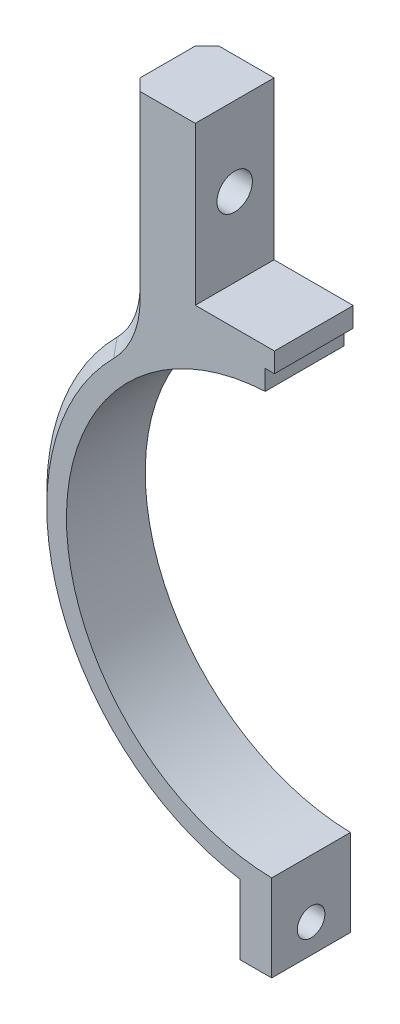
from build123d import *

# Parameters (mm, degrees)
AUFSATZ_LINEAR_AUSTRAGEN1_DEPTH = 10
SKIZZE2_R                       = 1.75
SCHNITT_LINEAR_AUSTRAGEN1_DEPTH = 64.134024107
SKIZZE4_R                       = 2.25
SCHNITT_LINEAR_AUSTRAGEN3_DEPTH = 72.992812141
VERRUNDUNG1_R                   = 10
SCHNITT_LINEAR_AUSTRAGEN5_DEPTH = 61.751172828
FASE1_SIZE                      = 1.5
SCHNITT_LINEAR_AUSTRAGEN6_DEPTH = 61.751172828


with BuildPart() as part:
    # Skizze1 → Aufsatz-Linear austragen1 (new body)
    with BuildSketch(Plane.XY):
        with BuildLine():
            Line((0.5, -26.545291485), (0.5, -30.545908073))
            Line((0.5, -30.545908073), (0.5, -37.545908073))
            Line((0.5, -37.545908073), (4.5, -37.545908073))
            Line((4.5, -37.545908073), (4.5, -30.216758595))
            ThreePointArc((4.5, -30.216758595), (29.558680329, -7.719256261), (18.7, 24.158073185))
            Line((18.7, 24.158073185), (18.7, 51.55))
            Line((18.7, 51.55), (10.2, 51.55))
            Line((10.2, 51.55), (10.2, 31.55))
            Line((10.2, 31.55), (-10.2, 31.55))
            Line((-10.2, 31.55), (-10.2, 51.55))
            Line((-10.2, 51.55), (-18.7, 51.55))
            Line((-18.7, 51.55), (-18.7, 24.158073185))
            ThreePointArc((-18.7, 24.158073185), (-29.558680329, -7.719256261), (-4.5, -30.216758595))
            Line((-4.5, -30.216758595), (-4.5, -37.545908073))
            Line((-4.5, -37.545908073), (-0.5, -37.545908073))
            Line((-0.5, -37.545908073), (-0.5, -30.545908073))
            Line((-0.5, -30.545908073), (-0.5, -26.545291485))
            ThreePointArc((-0.5, -26.545291485), (0, 26.55), (0.5, -26.545291485))
        make_face()
    extrude(amount=AUFSATZ_LINEAR_AUSTRAGEN1_DEPTH)

    # Skizze2 → Schnitt-Linear austragen1 (cut, through all)
    with BuildSketch(Plane.ZY.offset(4.5)):
        with Locations((5, -33.881333334)):
            Circle(SKIZZE2_R)
    extrude(amount=-SCHNITT_LINEAR_AUSTRAGEN1_DEPTH, mode=Mode.SUBTRACT)

    # Skizze4 → Schnitt-Linear austragen3 (cut, through all)
    with BuildSketch(Plane.ZY.offset(18.7)):
        with Locations((5, 41.55)):
            Circle(SKIZZE4_R)
    extrude(amount=-SCHNITT_LINEAR_AUSTRAGEN3_DEPTH, mode=Mode.SUBTRACT)

    # Verrundung1
    verrundung1_edges = [part.edges().sort_by_distance(p)[0] for p in [
        (18.7, 24.158073185, 5),
        (-18.7, 24.158073185, 5),
    ]]
    fillet(verrundung1_edges, radius=VERRUNDUNG1_R)

    # Skizze6 → Schnitt-Linear austragen5 (cut, through all)
    with BuildSketch(Plane.XY):
        Polygon((0, 0), (0, 63.91348789), (40.013946788, 63.91348789), (48.360414216, -54.819102682), (0, -54.819102682), align=None)
    extrude(amount=SCHNITT_LINEAR_AUSTRAGEN5_DEPTH, mode=Mode.SUBTRACT)

    # Fase1
    fase1_edges = [part.edges().sort_by_distance(p)[0] for p in [
        (-18.7, 40.098167422, 10),
        (-19.459415096, 24.823823807, 10),
        (-29.006358008, -9.588206043, 10),
        (-18.7, 40.098167422, 0),
        (-19.459415096, 24.823823807, 0),
        (-29.006358008, -9.588206043, 0),
    ]]
    chamfer(fase1_edges, length=FASE1_SIZE)

    # Skizze7 → Schnitt-Linear austragen6 (cut, through all)
    with BuildSketch(Plane.XY.offset(10)):
        Polygon((1.325, 29.05), (0, 29.05), (0, 31.55), (-0.15, 31.55), (-0.15, 29.05), (-1.325, 29.05), (-1.325, 25.137104209), (1.325, 25.137104209), align=None)
    extrude(amount=-SCHNITT_LINEAR_AUSTRAGEN6_DEPTH, mode=Mode.SUBTRACT)


solid = part.part
